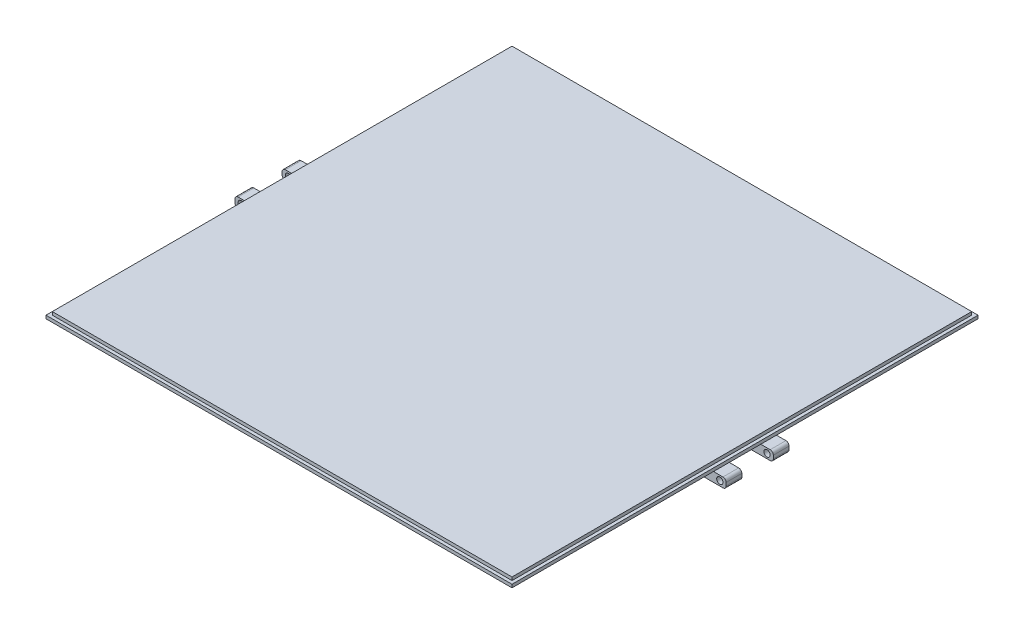
from build123d import *

# Parameters (mm, degrees)
SKETCH1_R           = 10
SKETCH1_R_2         = 7.5
BOSS_EXTRUDE1_DEPTH = 25
THREAD1_PITCH       = 0.3175
SKETCH4_W           = 146
SKETCH4_H           = 146
BOSS_EXTRUDE2_DEPTH = 2
SKETCH5_W           = 148
SKETCH5_H           = 148
BOSS_EXTRUDE3_DEPTH = 1
BOSS_EXTRUDE4_START = 7.5
SKETCH6_W           = 10
SKETCH6_H           = 3
SKETCH6_R           = 1
BOSS_EXTRUDE4_DEPTH = 2.5
BOSS_EXTRUDE5_START = -7.5
SKETCH6_2_W         = 10
SKETCH6_2_H         = 3
SKETCH6_2_R         = 1
BOSS_EXTRUDE5_DEPTH = 2.5
SKETCH9_R           = 18.995637602
CUT_EXTRUDE1_DEPTH  = 111.385687501
CHAMFER1_SIZE       = 3
FILLET1_R           = 1


with BuildPart() as part:
    # Sketch1 → Boss-Extrude1 (new body)
    with BuildSketch(Plane(origin=(0, 0, 0), x_dir=(1, 0, 0), z_dir=(0, 1, 0))):
        with Locations(Location((0, 0, 0), (0, 0, 270))):
            Circle(SKETCH1_R)
        with Locations(Location((0, 0, 0), (0, 0, 270))):
            Circle(SKETCH1_R_2, mode=Mode.SUBTRACT)
    extrude(amount=BOSS_EXTRUDE1_DEPTH)

    # Thread1: the profile of Thread Profile1 profile screwed along a right-hand helix of 18.897638 turns, 6 arcs to a turn; built about Z, then put on its axis
    thread1_z = Axis((0, 0, 0), (0, 0, 1))
    thread1_corners = [(10.0003, 0, -0.000173205), (10.0003, 0, 0.277985704), (9.828148085, 0, 0.17859375), (9.828148085, 0, 0.09921875)]
    with BuildLine(mode=Mode.PRIVATE) as thread1_profile:
        Line(thread1_corners[0], thread1_corners[1])
        Line(thread1_corners[1], thread1_corners[2])
        Line(thread1_corners[2], thread1_corners[3])
        Line(thread1_corners[3], thread1_corners[0])
    thread1_cap = Face(thread1_profile.wire())
    thread1_turn_angles = [0, 30, 60, 90, 120, 150, 180, 210, 240, 270, 300, 330, 360]
    thread1_turn_weights = [1, 0.8660254037844387, 1, 0.8660254037844387, 1, 0.8660254037844387, 1, 0.8660254037844387, 1, 0.8660254037844387, 1, 0.8660254037844387, 1]
    thread1_turn_rails = [Edge.make_bspline([Vector(p[0], p[1], 0).rotate(thread1_z, thread1_turn_angles[k]) / thread1_turn_weights[k] + Vector(0, 0, p[2] + THREAD1_PITCH * thread1_turn_angles[k] / 360) for k in range(13)], [0, 0, 0, 1, 1, 2, 2, 3, 3, 4, 4, 5, 5, 6, 6, 6], 2, thread1_turn_weights) for p in thread1_corners]
    thread1_turn_sides = [Face.make_surface_from_curves(thread1_turn_rails[p[0]], thread1_turn_rails[p[1]]) for p in [(0, 1), (1, 2), (2, 3), (3, 0)]]
    thread1_last_angles = [6480, 6510, 6540, 6570, 6600, 6630, 6660, 6690, 6720, 6750, 6780, 6791.57480315, 6803.149606299]
    thread1_last_weights = [1, 0.8660254037844387, 1, 0.8660254037844387, 1, 0.8660254037844387, 1, 0.8660254037844387, 1, 0.8660254037844387, 1, 0.9796635825089068, 1]
    thread1_last_rails = [Edge.make_bspline([Vector(p[0], p[1], 0).rotate(thread1_z, thread1_last_angles[k]) / thread1_last_weights[k] + Vector(0, 0, p[2] + THREAD1_PITCH * thread1_last_angles[k] / 360) for k in range(13)], [0, 0, 0, 1, 1, 2, 2, 3, 3, 4, 4, 5, 5, 6, 6, 6], 2, thread1_last_weights) for p in thread1_corners]
    thread1_last_sides = [Face.make_surface_from_curves(thread1_last_rails[p[0]], thread1_last_rails[p[1]]) for p in [(0, 1), (1, 2), (2, 3), (3, 0)]]
    thread1 = Plane(origin=(0, -0.5, 0), x_dir=(1, 0, 0), z_dir=(0, 1, 0)) * Solid(Shell([*[p.moved(Location((0, 0, THREAD1_PITCH * i))) for i in range(18) for p in thread1_turn_sides], *thread1_last_sides, thread1_cap, thread1_cap.rotate(thread1_z, 6803.149606299).moved(Location((0, 0, THREAD1_PITCH * 6803.149606299 / 360)))]))
    add(thread1, mode=Mode.SUBTRACT)

    # Sketch4 → Boss-Extrude2 (add)
    with BuildSketch(Plane(origin=(0, 25, 0), x_dir=(1, 0, 0), z_dir=(0, 1, 0))):
        Rectangle(SKETCH4_W, SKETCH4_H)
    extrude(amount=BOSS_EXTRUDE2_DEPTH)

    # Sketch5 → Boss-Extrude3 (add)
    with BuildSketch(Plane.XZ.offset(-25)):
        Rectangle(SKETCH5_W, SKETCH5_H)
    extrude(amount=-BOSS_EXTRUDE3_DEPTH)

    # Sketch6 → Boss-Extrude4 (add, symmetric)
    # profile 1 of 2: a face of its own
    with BuildSketch(Plane.XY.offset(BOSS_EXTRUDE4_START)):
        with Locations((73, 23.5)):
            Rectangle(SKETCH6_W, SKETCH6_H)
        with Locations((76, 23.5)):
            Circle(SKETCH6_R, mode=Mode.SUBTRACT)
    # profile 2 of 2: a face of its own
    with BuildSketch(Plane.XY.offset(BOSS_EXTRUDE4_START)):
        with Locations((-73, 23.5)):
            Rectangle(SKETCH6_W, SKETCH6_H)
        with Locations(Location((-76, 23.5, 0), (0, 0, 180))):
            Circle(SKETCH6_R, mode=Mode.SUBTRACT)
    extrude(amount=BOSS_EXTRUDE4_DEPTH, both=True)

    # Sketch6<2> → Boss-Extrude5 (add, symmetric)
    # profile 1 of 2: a face of its own
    with BuildSketch(Plane.XY.offset(BOSS_EXTRUDE5_START)):
        with Locations((73, 23.5)):
            Rectangle(SKETCH6_2_W, SKETCH6_2_H)
        with Locations((76, 23.5)):
            Circle(SKETCH6_2_R, mode=Mode.SUBTRACT)
    # profile 2 of 2: a face of its own
    with BuildSketch(Plane.XY.offset(BOSS_EXTRUDE5_START)):
        with Locations((-73, 23.5)):
            Rectangle(SKETCH6_2_W, SKETCH6_2_H)
        with Locations(Location((-76, 23.5, 0), (0, 0, 180))):
            Circle(SKETCH6_2_R, mode=Mode.SUBTRACT)
    extrude(amount=BOSS_EXTRUDE5_DEPTH, both=True)

    # Sketch9 → Cut-Extrude1 (cut, through all)
    with BuildSketch(Plane.XZ.offset(-25)):
        Circle(SKETCH9_R)
    extrude(amount=CUT_EXTRUDE1_DEPTH, mode=Mode.SUBTRACT)

    # Chamfer1
    chamfer1_edges = [part.edges().sort_by_distance(p)[0] for p in [
        (68, 25, -7.5),
        (68, 25, 7.5),
        (-68, 25, -7.5),
        (-68, 25, 7.5),
    ]]
    chamfer(chamfer1_edges, length=CHAMFER1_SIZE - 0.0001)  # a hair under: the kernel refuses the full size

    # Fillet1
    fillet1_edges = [part.edges().sort_by_distance(p)[0] for p in [
        (78, 22, -7.5),
        (78, 25, -7.5),
        (-78, 25, -7.5),
        (-78, 22, -7.5),
        (78, 22, 7.5),
        (78, 25, 7.5),
        (-78, 25, 7.5),
        (-78, 22, 7.5),
    ]]
    fillet(fillet1_edges, radius=FILLET1_R)


solid = part.part
